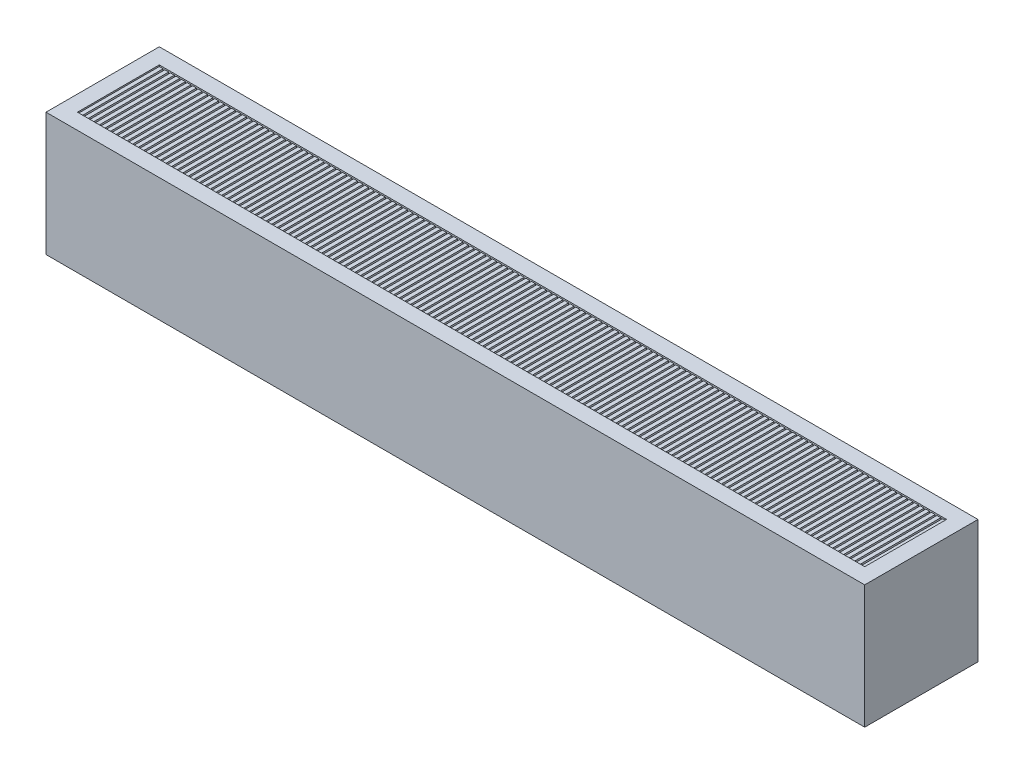
from build123d import *

# Parameters (mm, degrees)
SKETCH1_W           = 737
SKETCH1_H           = 102
BOSS_EXTRUDE1_DEPTH = 111
SKETCH2_W           = 708.715728752
SKETCH2_H           = 73.715728752
CUT_EXTRUDE1_DEPTH  = 12
SKETCH10_W          = 3.468502946
SKETCH10_H          = 10.717337874
BOSS_EXTRUDE3_DEPTH = 74
LPATTERN1_COUNT     = 142
LPATTERN1_PITCH     = 5


with BuildPart() as part:
    # Sketch1 → Boss-Extrude1 (new body)
    with BuildSketch(Plane(origin=(0, 0, 0), x_dir=(1, 0, 0), z_dir=(0, 1, 0))):
        with Locations((368.5, 51)):
            Rectangle(SKETCH1_W, SKETCH1_H)
    extrude(amount=BOSS_EXTRUDE1_DEPTH)

    # Sketch2 → Cut-Extrude1 (cut)
    with BuildSketch(Plane(origin=(0, 111, 0), x_dir=(1, 0, 0), z_dir=(0, 1, 0))):
        with Locations((368.5, 51)):
            Rectangle(SKETCH2_W, SKETCH2_H)
    extrude(amount=-CUT_EXTRUDE1_DEPTH, mode=Mode.SUBTRACT)

    # Sketch10 → Boss-Extrude3 (add)
    with BuildSketch(Plane.XY.offset(-87.857864376)):
        with Locations((15.876387097, 104.358668937)):
            Rectangle(SKETCH10_W, SKETCH10_H)
    boss_extrude3 = extrude(amount=BOSS_EXTRUDE3_DEPTH)

    # LPattern1: Boss-Extrude3 ×142
    with Locations(*[(i * LPATTERN1_PITCH, 0, 0) for i in range(1, LPATTERN1_COUNT)]):
        add(boss_extrude3)


solid = part.part
